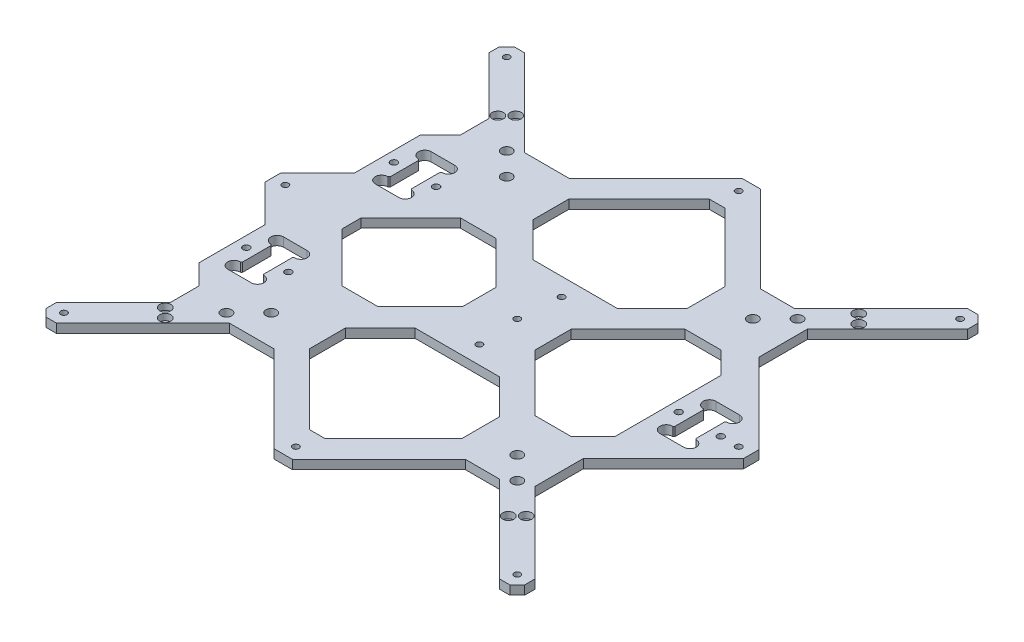
from build123d import *

# Parameters (mm, degrees)
SKETCH2_R            = 1.5
SKETCH2_R_2          = 1.6
BOSS_EXTRUDE2_DEPTH  = 4.25
SKETCH4_R            = 2.5
HOLES_TO_DRILL_DEPTH = 416.108494854
SKETCH6_R            = 1.5
CUT_EXTRUDE1_DEPTH   = 416.108494854
SKETCH7_R            = 2.65
CUT_EXTRUDE2_DEPTH   = 3


with BuildPart() as part:
    # Sketch2 → Boss-Extrude2 (new body)
    with BuildSketch(Plane(origin=(0, 0, 0), x_dir=(1, 0, 0), z_dir=(0, 1, 0))):
        Polygon((225.400116, 255), (184.400116, 296), (175.599884, 296), (134.599884, 255), (113.485281374, 255), (72.485281374, 296), (67.514830223, 296), (64, 292.485169777), (64, 287.514718626), (91, 260.514718626), (91, 247), (81.5, 237.5), (81.5, 206.239105), (64, 188.739105), (64, 181.260895), (81.5, 163.760895), (81.5, 132.5), (91, 123), (91, 109.485281374), (64, 82.485281374), (64, 77.514830223), (67.514830223, 74), (72.485281374, 74), (113.485281374, 115), (134.599884, 115), (175.599884, 74), (184.400116, 74), (225.400116, 115), (241.514718626, 115), (282.514718626, 74), (287.485169777, 74), (291, 77.514830223), (291, 82.485281374), (253, 120.485281374), (253, 143.333039), (291, 181.333039), (291, 188.666961), (253, 226.666961), (253, 249.514718626), (291, 287.514718626), (291, 292.485169777), (287.485169777, 296), (282.514718626, 296), (241.514718626, 255), align=None)
        with Locations((70, 80)):
            Circle(SKETCH2_R, mode=Mode.SUBTRACT)
        with Locations((180, 80)):
            Circle(SKETCH2_R, mode=Mode.SUBTRACT)
        with Locations((86.5, 150)):
            Circle(SKETCH2_R_2, mode=Mode.SUBTRACT)
        with Locations((70, 185)):
            Circle(SKETCH2_R, mode=Mode.SUBTRACT)
        Polygon((176.317383, 90.266846), (143, 123.584229), (143, 140.433686), (159.566314, 157), (199.51474, 157), (216, 140.51474), (216, 122.570419884), (183.682617, 90.253036884), align=None, mode=Mode.SUBTRACT)
        with BuildLine():
            Line((102.000000013, 157.25), (101.500000013, 156.75))
            Line((101.500000013, 156.75), (101.500000013, 143.25))
            Line((101.500000013, 143.25), (102.000000013, 142.75))
            Line((102.000000013, 142.75), (102.100000157, 142.75))
            ThreePointArc((102.100000157, 142.75), (105.1, 139.75), (102.100000157, 136.75))
            Line((102.100000157, 136.75), (90.899999843, 136.75))
            ThreePointArc((90.899999843, 136.75), (87.9, 139.75), (90.899999843, 142.75))
            Line((90.899999843, 142.75), (90.999999987, 142.75))
            Line((90.999999987, 142.75), (91.499999987, 143.25))
            Line((91.499999987, 143.25), (91.499999987, 156.75))
            Line((91.499999987, 156.75), (90.999999987, 157.25))
            Line((90.999999987, 157.25), (90.899999843, 157.25))
            ThreePointArc((90.899999843, 157.25), (87.9, 160.25), (90.899999843, 163.25))
            Line((90.899999843, 163.25), (102.100000157, 163.25))
            ThreePointArc((102.100000157, 163.25), (105.100000157, 160.25), (102.100000157, 157.25))
            Line((102.100000157, 157.25), (102.000000013, 157.25))
        make_face(mode=Mode.SUBTRACT)
        with Locations((106.5, 150)):
            Circle(SKETCH2_R_2, mode=Mode.SUBTRACT)
        with Locations((181.5, 165.5)):
            Circle(SKETCH2_R, mode=Mode.SUBTRACT)
        with Locations((285, 80)):
            Circle(SKETCH2_R, mode=Mode.SUBTRACT)
        with Locations((86.5, 220)):
            Circle(SKETCH2_R_2, mode=Mode.SUBTRACT)
        Polygon((162, 192.97703218), (162, 177.02296782), (141.97703218, 157), (124.999970007, 157), (101.5, 180.5), (101.5, 189.5), (124.999970007, 213), (141.97703218, 213), align=None, mode=Mode.SUBTRACT)
        with BuildLine():
            Line((102.000000013, 227.25), (101.500000013, 226.75))
            Line((101.500000013, 226.75), (101.500000013, 213.25))
            Line((101.500000013, 213.25), (102.000000013, 212.75))
            Line((102.000000013, 212.75), (102.100000157, 212.75))
            ThreePointArc((102.100000157, 212.75), (105.1, 209.75), (102.100000157, 206.75))
            Line((102.100000157, 206.75), (90.899999843, 206.75))
            ThreePointArc((90.899999843, 206.75), (87.9, 209.75), (90.899999843, 212.75))
            Line((90.899999843, 212.75), (90.999999987, 212.75))
            Line((90.999999987, 212.75), (91.499999987, 213.25))
            Line((91.499999987, 213.25), (91.499999987, 226.75))
            Line((91.499999987, 226.75), (90.999999987, 227.25))
            Line((90.999999987, 227.25), (90.899999843, 227.25))
            ThreePointArc((90.899999843, 227.25), (87.9, 230.25), (90.899999843, 233.25))
            Line((90.899999843, 233.25), (102.100000157, 233.25))
            ThreePointArc((102.100000157, 233.25), (105.100000157, 230.25), (102.100000157, 227.25))
            Line((102.100000157, 227.25), (102.000000013, 227.25))
        make_face(mode=Mode.SUBTRACT)
        with Locations((106.5, 220)):
            Circle(SKETCH2_R_2, mode=Mode.SUBTRACT)
        with Locations((180, 185)):
            Circle(SKETCH2_R, mode=Mode.SUBTRACT)
        with Locations((181.5, 204.5)):
            Circle(SKETCH2_R, mode=Mode.SUBTRACT)
        Polygon((143, 229.566314), (143, 246.415771), (176.317383, 279.733154), (183.682617, 279.746963116), (216, 247.429580116), (216, 229.48526), (199.51474, 213), (159.566314, 213), align=None, mode=Mode.SUBTRACT)
        with Locations((70, 290)):
            Circle(SKETCH2_R, mode=Mode.SUBTRACT)
        with Locations((180, 290)):
            Circle(SKETCH2_R, mode=Mode.SUBTRACT)
        Polygon((240.98529, 220.529449), (251.5, 210.014709), (251.5, 159.985291), (240.98529, 149.470551), (224.014709, 149.470551), (197, 176.48526), (197, 193.51474), (224.014709, 220.529449), align=None, mode=Mode.SUBTRACT)
        with Locations((256.5, 185)):
            Circle(SKETCH2_R_2, mode=Mode.SUBTRACT)
        with BuildLine():
            Line((272.000000013, 192.25), (271.500000013, 191.75))
            Line((271.500000013, 191.75), (271.500000013, 178.25))
            Line((271.500000013, 178.25), (272.000000013, 177.75))
            Line((272.000000013, 177.75), (272.100000157, 177.75))
            ThreePointArc((272.100000157, 177.75), (275.100000157, 174.75), (272.100000157, 171.75))
            Line((272.100000157, 171.75), (260.899999843, 171.75))
            ThreePointArc((260.899999843, 171.75), (257.9, 174.75), (260.899999843, 177.75))
            Line((260.899999843, 177.75), (260.999999987, 177.75))
            Line((260.999999987, 177.75), (261.499999987, 178.25))
            Line((261.499999987, 178.25), (261.499999987, 191.75))
            Line((261.499999987, 191.75), (260.999999987, 192.25))
            Line((260.999999987, 192.25), (260.899999843, 192.25))
            ThreePointArc((260.899999843, 192.25), (257.9, 195.25), (260.899999843, 198.25))
            Line((260.899999843, 198.25), (272.100000157, 198.25))
            ThreePointArc((272.100000157, 198.25), (275.100000157, 195.25), (272.100000157, 192.25))
            Line((272.100000157, 192.25), (272.000000013, 192.25))
        make_face(mode=Mode.SUBTRACT)
        with Locations((276.5, 185)):
            Circle(SKETCH2_R_2, mode=Mode.SUBTRACT)
        with Locations((285, 185)):
            Circle(SKETCH2_R, mode=Mode.SUBTRACT)
        with Locations((285, 290)):
            Circle(SKETCH2_R, mode=Mode.SUBTRACT)
    extrude(amount=BOSS_EXTRUDE2_DEPTH)

    # Sketch4 → Holes-to-drill (cut, through all)
    with BuildSketch(Plane(origin=(0, 4.25, 0), x_dir=(1, 0, 0), z_dir=(0, 1, 0))):
        with Locations((119.143977091, 129.143977091)):
            Circle(SKETCH4_R)
        with Locations((108.537375373, 118.537375373)):
            Circle(SKETCH4_R)
        with Locations((108.537375373, 251.462624627)):
            Circle(SKETCH4_R)
        with Locations((119.143977091, 240.856022909)):
            Circle(SKETCH4_R)
        with Locations((235.856022909, 240.856022909)):
            Circle(SKETCH4_R)
        with Locations((246.462624627, 251.462624627)):
            Circle(SKETCH4_R)
        with Locations((235.856022909, 129.143977091)):
            Circle(SKETCH4_R)
        with Locations((246.462624627, 118.537375373)):
            Circle(SKETCH4_R)
    extrude(amount=-HOLES_TO_DRILL_DEPTH, mode=Mode.SUBTRACT)

    # Sketch6 → Cut-Extrude1 (cut, through all)
    with BuildSketch(Plane(origin=(0, 4.25, 0), x_dir=(1, 0, 0), z_dir=(0, 1, 0))):
        with Locations((91.920366015, 106.163006703)):
            Circle(SKETCH6_R)
        with Locations((96.163006703, 101.920366015)):
            Circle(SKETCH6_R)
        with Locations((258.836993297, 101.920366015)):
            Circle(SKETCH6_R)
        with Locations((263.079633985, 106.163006703)):
            Circle(SKETCH6_R)
        with Locations((91.920366015, 263.836993297)):
            Circle(SKETCH6_R)
        with Locations((96.163006703, 268.079633985)):
            Circle(SKETCH6_R)
        with Locations((258.836993297, 268.079633985)):
            Circle(SKETCH6_R)
        with Locations((263.079633985, 263.836993297)):
            Circle(SKETCH6_R)
    extrude(amount=-CUT_EXTRUDE1_DEPTH, mode=Mode.SUBTRACT)

    # Sketch7 → Cut-Extrude2 (cut)
    with BuildSketch(Plane.XZ.offset(-4.25)):
        with Locations((91.920366015, -106.163006703)):
            Circle(SKETCH7_R)
        with Locations((96.163006703, -101.920366015)):
            Circle(SKETCH7_R)
        with Locations((258.836993297, -101.920366015)):
            Circle(SKETCH7_R)
        with Locations((263.079633985, -106.163006703)):
            Circle(SKETCH7_R)
        with Locations((91.920366015, -263.836993297)):
            Circle(SKETCH7_R)
        with Locations((96.163006703, -268.079633985)):
            Circle(SKETCH7_R)
        with Locations((258.836993297, -268.079633985)):
            Circle(SKETCH7_R)
        with Locations((263.079633985, -263.836993297)):
            Circle(SKETCH7_R)
    extrude(amount=CUT_EXTRUDE2_DEPTH, mode=Mode.SUBTRACT)


solid = part.part
